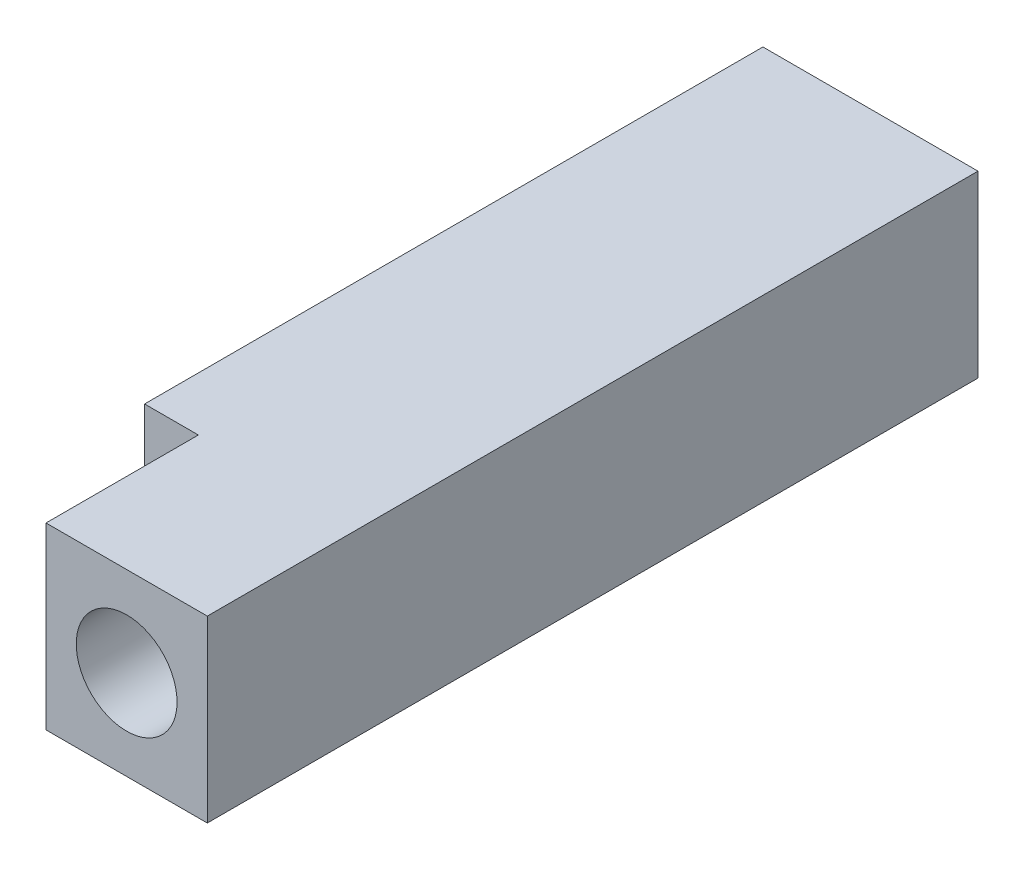
from build123d import *

# Parameters (mm, degrees)
SKETCH1_W           = 38.1
SKETCH1_H           = 25.4
BOSS_EXTRUDE1_DEPTH = 114.3
SKETCH3_R           = 5.1054
CUT_EXTRUDE2_DEPTH  = 110.109187972
CUT_EXTRUDE3_REACH  = 123.15
SKETCH4_R           = 4.445
SKETCH5_R           = 7.14375
CUT_EXTRUDE4_DEPTH  = 20.066
SKETCH1_3_W         = 38.1
SKETCH1_3_H         = 25.4
CUT_EXTRUDE7_DEPTH  = 5.08
SKETCH15_W          = 109.22
SKETCH15_H          = 25.4
CUT_EXTRUDE8_DEPTH  = 7.62
SKETCH17_W          = 21.59
SKETCH17_H          = 25.4
CUT_EXTRUDE9_DEPTH  = 7.62


with BuildPart() as part:
    # Sketch1 → Boss-Extrude1 (new body)
    with BuildSketch(Plane.XY):
        Rectangle(SKETCH1_W, SKETCH1_H)
    extrude(amount=BOSS_EXTRUDE1_DEPTH)

    # Sketch3 → Cut-Extrude2 (cut, through all)
    with BuildSketch(Plane(origin=(0, 0, 7.62), x_dir=(-1, 0, 0), z_dir=(0, 0, -1))):
        Circle(SKETCH3_R)
    extrude(amount=-CUT_EXTRUDE2_DEPTH, mode=Mode.SUBTRACT)

    # Sketch4 → Cut-Extrude3 (cut, up to next)
    with BuildSketch(Plane.ZY.offset(19.05), mode=Mode.PRIVATE) as cut_extrude3_sk1:
        with Locations((16.5354, 0)):
            Circle(SKETCH4_R)
    cut_extrude3_tool1 = extrude(cut_extrude3_sk1.sketch, amount=-CUT_EXTRUDE3_REACH, mode=Mode.PRIVATE) & part.part
    # Sketch4 → Cut-Extrude3 (cut, up to next)
    with BuildSketch(Plane.ZY.offset(19.05), mode=Mode.PRIVATE) as cut_extrude3_sk2:
        with Locations((33.0454, 0)):
            Circle(SKETCH4_R)
    cut_extrude3_tool2 = extrude(cut_extrude3_sk2.sketch, amount=-CUT_EXTRUDE3_REACH, mode=Mode.PRIVATE) & part.part
    # Sketch4 → Cut-Extrude3 (cut, up to next)
    with BuildSketch(Plane.ZY.offset(19.05), mode=Mode.PRIVATE) as cut_extrude3_sk3:
        with Locations((49.5554, 0)):
            Circle(SKETCH4_R)
    cut_extrude3_tool3 = extrude(cut_extrude3_sk3.sketch, amount=-CUT_EXTRUDE3_REACH, mode=Mode.PRIVATE) & part.part
    # Sketch4 → Cut-Extrude3 (cut, up to next)
    with BuildSketch(Plane.ZY.offset(19.05), mode=Mode.PRIVATE) as cut_extrude3_sk4:
        with Locations((66.0654, 0)):
            Circle(SKETCH4_R)
    cut_extrude3_tool4 = extrude(cut_extrude3_sk4.sketch, amount=-CUT_EXTRUDE3_REACH, mode=Mode.PRIVATE) & part.part
    # Sketch4 → Cut-Extrude3 (cut, up to next)
    with BuildSketch(Plane.ZY.offset(19.05), mode=Mode.PRIVATE) as cut_extrude3_sk5:
        with Locations((82.5754, 0)):
            Circle(SKETCH4_R)
    cut_extrude3_tool5 = extrude(cut_extrude3_sk5.sketch, amount=-CUT_EXTRUDE3_REACH, mode=Mode.PRIVATE) & part.part
    add(cut_extrude3_tool1.solids().sort_by_distance((-19.05, 0, 16.5354))[0], mode=Mode.SUBTRACT)
    add(cut_extrude3_tool2.solids().sort_by_distance((-19.05, 0, 33.0454))[0], mode=Mode.SUBTRACT)
    add(cut_extrude3_tool3.solids().sort_by_distance((-19.05, 0, 49.5554))[0], mode=Mode.SUBTRACT)
    add(cut_extrude3_tool4.solids().sort_by_distance((-19.05, 0, 66.0654))[0], mode=Mode.SUBTRACT)
    add(cut_extrude3_tool5.solids().sort_by_distance((-19.05, 0, 82.5754))[0], mode=Mode.SUBTRACT)

    # Sketch5 → Cut-Extrude4 (cut)
    with BuildSketch(Plane.XY.offset(114.3)):
        Circle(SKETCH5_R)
    extrude(amount=-CUT_EXTRUDE4_DEPTH, mode=Mode.SUBTRACT)

    # Sketch1<3> → Cut-Extrude7 (cut)
    with BuildSketch(Plane.XY):
        Rectangle(SKETCH1_3_W, SKETCH1_3_H)
    extrude(amount=CUT_EXTRUDE7_DEPTH, mode=Mode.SUBTRACT)

    # Sketch15 → Cut-Extrude8 (cut)
    with BuildSketch(Plane(origin=(19.05, 0, 0), x_dir=(0, 0, -1), z_dir=(1, 0, 0))):
        with Locations((-59.69, 0)):
            Rectangle(SKETCH15_W, SKETCH15_H)
    extrude(amount=-CUT_EXTRUDE8_DEPTH, mode=Mode.SUBTRACT)

    # Sketch17 → Cut-Extrude9 (cut)
    with BuildSketch(Plane.ZY.offset(19.05)):
        with Locations((103.505, 0)):
            Rectangle(SKETCH17_W, SKETCH17_H)
    extrude(amount=-CUT_EXTRUDE9_DEPTH, mode=Mode.SUBTRACT)


solid = part.part
